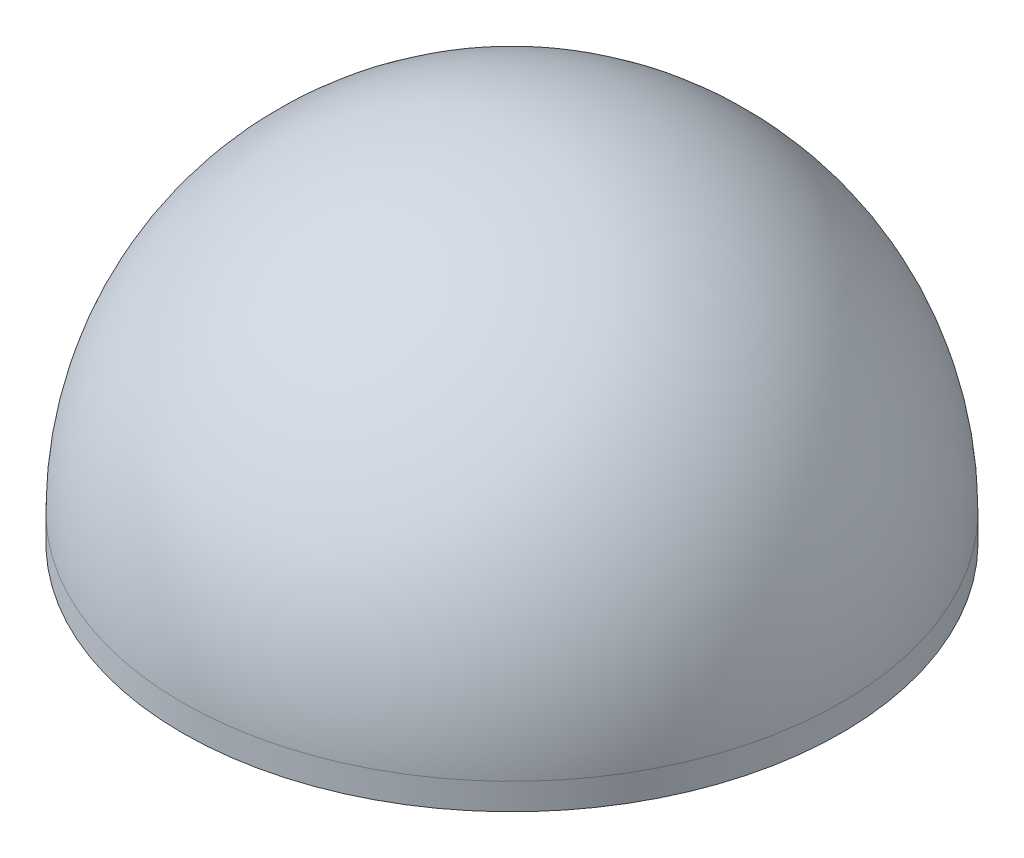
from build123d import *

# Parameters (mm, degrees)
SKETCH1_R           = 25
BOSS_EXTRUDE1_DEPTH = 2
DOME1_FACE_RADIUS   = 25
DOME1_HEIGHT        = 25


# Read off the part's stored shape, not the designer's step: Shell1
with BuildPart() as part:
    # Sketch1 → Boss-Extrude1 (new body)
    with BuildSketch(Plane(origin=(0, 0, 0), x_dir=(1, 0, 0), z_dir=(0, 1, 0))):
        with Locations(Location((0, 0, 0), (0, 0, 270))):
            Circle(SKETCH1_R)
    extrude(amount=BOSS_EXTRUDE1_DEPTH)

    # Dome1: a dome of height H over a round flat face of radius A is a cap of a sphere of radius (A * A + H * H) / (2 * H)
    dome1_r = (DOME1_FACE_RADIUS * DOME1_FACE_RADIUS + DOME1_HEIGHT * DOME1_HEIGHT) / (2 * DOME1_HEIGHT)
    dome1_base = Plane((0, 2, 0), z_dir=(0, 1, 0))
    with Locations(dome1_base.offset(DOME1_HEIGHT - dome1_r)):
        dome1_ball = Sphere(dome1_r, mode=Mode.PRIVATE)
    add(split(dome1_ball, bisect_by=dome1_base, keep=Keep.TOP, mode=Mode.PRIVATE))

    # Shell1 outline → Shell1 (revolve, cut)
    with BuildSketch(Plane.XY):
        with BuildLine():
            Line((23, 0), (23, 1.999999977))
            ThreePointArc((23, 1.999999977), (16.263455975, 18.263455959), (0, 25))
            Line((0, 25), (0, 0))
            Line((0, 0), (23, 0))
        make_face()
    revolve(axis=Axis((0, 0, 0), (0, 1, 0)), mode=Mode.SUBTRACT)


solid = part.part
